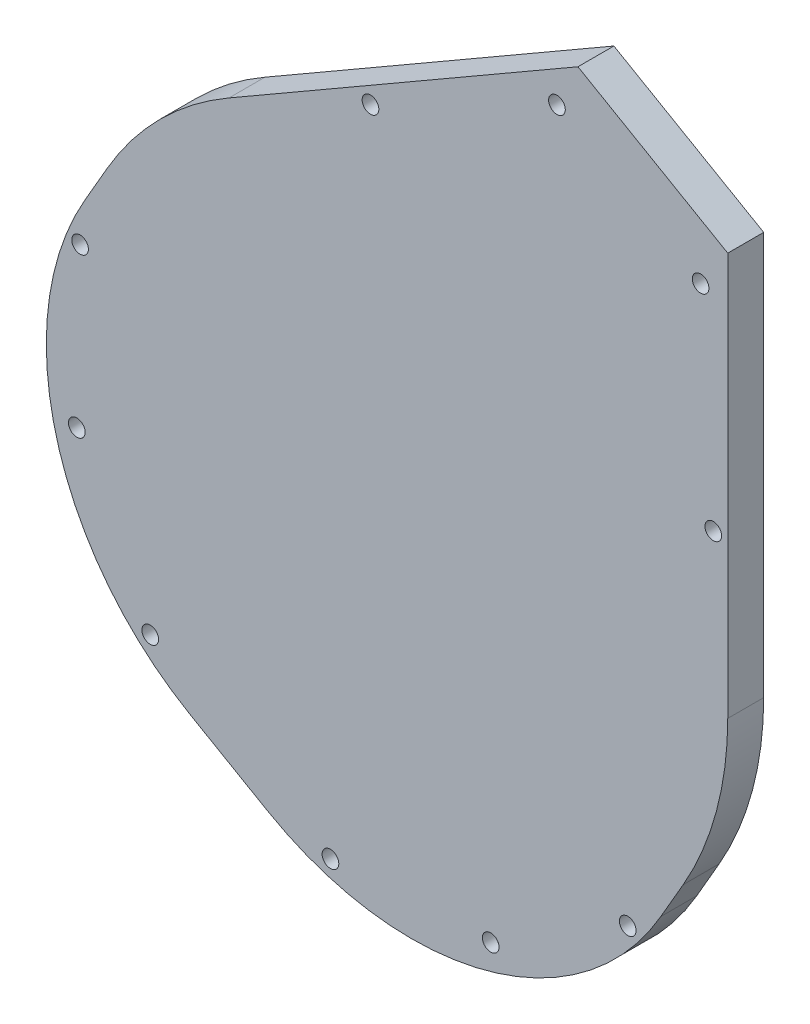
from build123d import *

# Parameters (mm, degrees)
BOSS_EXTRUDE2_DEPTH         = 6.35
F_4_CLEARANCE_HOLE1_D       = 2.9464
CUT_EXTRUDE2_DASH_048_DEPTH = 1.3208
FILLET1_R                   = 50.8


with BuildPart() as part:
    # Sketch3 → Boss-Extrude2 (new body)
    with BuildSketch(Plane(origin=(0.103482409, 1.991370524, 0), x_dir=(1, 0, 0), z_dir=(0, 0, 1))):
        with BuildLine():
            Line((58.7375, 0), (58.7375, 71.178534783))
            Line((58.7375, 71.178534783), (32.273669326, 86.457434546))
            Line((32.273669326, 86.457434546), (-29.36875, 50.868167155))
            ThreePointArc((-29.36875, 50.868167155), (-41.53368456, 41.53368456), (-50.868167155, 29.36875))
            Line((-50.868167155, 29.36875), (-80.236917155, -21.499417155))
            Line((-80.236917155, -21.499417155), (21.499417155, -80.236917155))
            Line((21.499417155, -80.236917155), (50.868167155, -29.36875))
            ThreePointArc((50.868167155, -29.36875), (56.736068222, -15.202383662), (58.7375, 0))
        make_face()
    extrude(amount=BOSS_EXTRUDE2_DEPTH)

    # #4 Clearance Hole1 (through all)
    with Locations(Plane.XY.offset(6.35)):
        with Locations((28.667480209, 80.767509471), (54.04362105, 66.116587726), (-4.272114917, 64.335461198), (-55.5710271, 17.274918559), (-56.146896149, -11.01373469), (-43.178667679, -36.217180003), (-11.345017944, -54.596346246), (16.965920195, -53.225438887), (41.176678022, -38.582395037), (56.282847372, 29.37403742)):
            Hole(F_4_CLEARANCE_HOLE1_D / 2)

    # Sketch6 → Cut-Extrude2 - dash 048 (cut)
    with BuildSketch(Plane(origin=(0.103482409, 1.991370524, 0), x_dir=(1, 0, 0), z_dir=(0, 0, 1))):
        with BuildLine():
            Line((55.672086916, 3.229866087), (52.009478425, 63.620294443))
            ThreePointArc((52.009478425, 63.620294443), (44.021350779, 76.247216167), (29.092051971, 76.851676775))
            Line((29.092051971, 76.851676775), (-25.038897376, 49.828374594))
            ThreePointArc((-25.038897376, 49.828374594), (-27.88285, -48.29451286), (55.672086916, 3.229866087))
        make_face()
        with BuildLine():
            Line((53.466162602, 3.099012969), (49.805143409, 63.46323641))
            ThreePointArc((49.805143409, 63.46323641), (42.916450779, 74.33347323), (30.058203233, 74.864137637))
            Line((30.058203233, 74.864137637), (-24.049257344, 47.852561541))
            ThreePointArc((-24.049257344, 47.852561541), (-26.77795, -46.380769923), (53.466162602, 3.099012969))
        make_face(mode=Mode.SUBTRACT)
    extrude(amount=CUT_EXTRUDE2_DASH_048_DEPTH, mode=Mode.SUBTRACT)

    # Fillet1
    fillet1_edges = [part.edges().sort_by_distance(p)[0] for p in [
        (-80.133434745, -19.508046631, 3.175),
        (21.602899564, -78.245546631, 3.175),
    ]]
    fillet(fillet1_edges, radius=FILLET1_R)


solid = part.part
